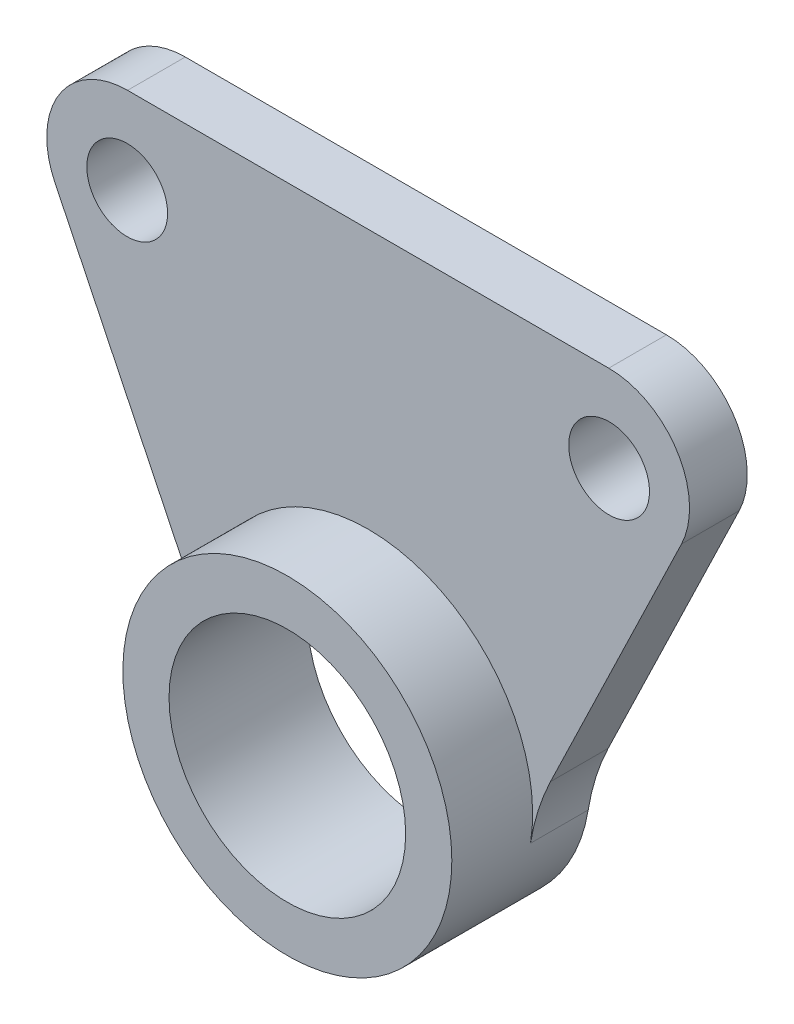
from build123d import *

# Parameters (mm, degrees)
ESQUISSE1_R        = 7.125
ESQUISSE1_R_2      = 5.125
BOSS_EXTRU_1_DEPTH = 6
ESQUISSE1_3_R      = 1.75
BOSS_EXTRU_2_DEPTH = 2.5
CONG_1_R           = 3.5
CONG_2_R           = 10


with BuildPart() as part:
    # Esquisse1 → Boss.-Extru.1 (new body)
    with BuildSketch(Plane.XY):
        Circle(ESQUISSE1_R)
        Circle(ESQUISSE1_R_2, mode=Mode.SUBTRACT)
    extrude(amount=BOSS_EXTRU_1_DEPTH)

    # Esquisse1<3> → Boss.-Extru.2 (add)
    # profile 1 of 2: a face of its own
    with BuildSketch(Plane.XY):
        with BuildLine():
            Line((-15.998397436, 18.375), (-7.125, 0))
            ThreePointArc((-7.125, 0), (-5.038135816, 5.038135816), (0, 7.125))
            Line((0, 7.125), (0, 18.375))
            Line((0, 18.375), (-15.998397436, 18.375))
        make_face()
        with Locations((-10.4375, 14.625)):
            Circle(ESQUISSE1_3_R, mode=Mode.SUBTRACT)
    # profile 2 of 2: a face of its own
    with BuildSketch(Plane.XY):
        with BuildLine():
            ThreePointArc((0, 7.125), (5.038135816, 5.038135816), (7.125, 0))
            Line((7.125, 0), (15.998397436, 18.375))
            Line((15.998397436, 18.375), (0, 18.375))
            Line((0, 18.375), (0, 7.125))
        make_face()
        with Locations((10.4375, 14.625)):
            Circle(ESQUISSE1_3_R, mode=Mode.SUBTRACT)
    extrude(amount=BOSS_EXTRU_2_DEPTH)

    # Congé1
    cong_1_edges = [part.edges().sort_by_distance(p)[0] for p in [
        (15.998397436, 18.375, 1.25),
        (-15.998397436, 18.375, 1.25),
    ]]
    fillet(cong_1_edges, radius=CONG_1_R)

    # Congé2
    # the kernel refuses this fillet: 10 mm, written as the material it adds along each edge
    with BuildSketch(Plane(origin=(-7.125, 0, 0), x_dir=(0.08048003783871222, -0.9967562207026748, 0), z_dir=(0, 0, 1))) as cong_2_piece_1:
        with BuildLine():
            CenterArc((1.951640918, -9.967562207), CONG_2_R, 94.61615885, 16.543856934)
            Line((-1.658097624, -0.641802846), (0, 0))
            ThreePointArc((0, 0), (0.57342027, -0.023111927), (1.146840539, 0))
        make_face()
    extrude(amount=2.5)
    with BuildSketch(Plane(origin=(7.125, 0, 0), x_dir=(0.4348566812294863, 0.900499676174332, 0), z_dir=(0, 0, 1))) as cong_2_piece_2:
        with BuildLine():
            CenterArc((1.77797599, -10), CONG_2_R, 90, 16.543856934)
            ThreePointArc((-1.069515889, -0.413979449), (-0.526415143, -0.228543352), (0, 0))
            Line((0, 0), (1.77797599, 0))
        make_face()
    extrude(amount=2.5)


solid = part.part
